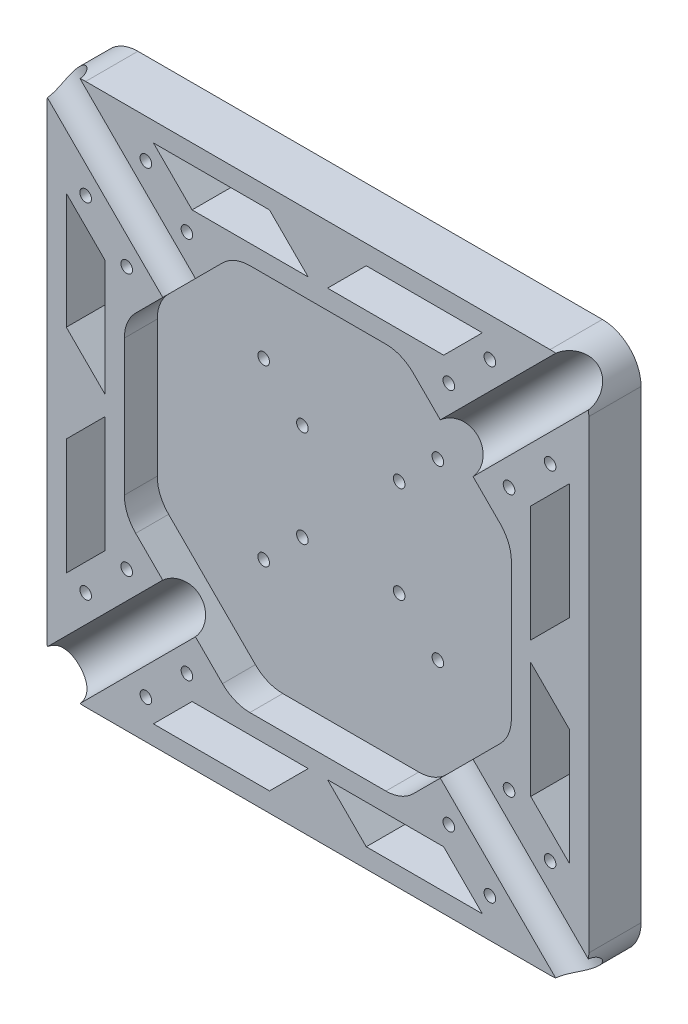
from build123d import *

# Parameters (mm, degrees)
ESQUISSE1_W                  = 140
ESQUISSE1_H                  = 140
BOSS_EXTRU_1_DEPTH           = 13.5
ENL_V_MAT_EXTRU_3_DEPTH      = 8.5
ENL_V_MAT_EXTRU_1_DEPTH      = 100
R_P_TITION_CIRCULAIRE1_COUNT = 2
R_P_TITION_CIRCULAIRE1_ANGLE = 90
CONG_1_R                     = 10
ESQUISSE3_R                  = 1.5
ENL_V_MAT_EXTRU_2_DEPTH      = 13.5
ENL_V_MAT_EXTRU_4_DEPTH      = 10
ENL_V_MAT_EXTRU_4_DEPTH_BACK = 12.5
ESQUISSE5_R                  = 1.5


with BuildPart() as part:
    # Esquisse1 → Boss.-Extru.1 (new body)
    with BuildSketch(Plane.XY):
        Rectangle(ESQUISSE1_W, ESQUISSE1_H)
        Polygon((65, 12.5), (55, 2.5), (55, 32.5), (65, 42.5), align=None, mode=Mode.SUBTRACT)
        Polygon((65, -12.5), (55, -2.5), (55, -32.5), (65, -42.5), align=None, mode=Mode.SUBTRACT)
        Polygon((12.5, -65), (2.5, -55), (32.5, -55), (42.5, -65), align=None, mode=Mode.SUBTRACT)
        Polygon((-12.5, -65), (-2.5, -55), (-32.5, -55), (-42.5, -65), align=None, mode=Mode.SUBTRACT)
        Polygon((-65, -12.5), (-55, -2.5), (-55, -32.5), (-65, -42.5), align=None, mode=Mode.SUBTRACT)
        Polygon((-65, 12.5), (-55, 2.5), (-55, 32.5), (-65, 42.5), align=None, mode=Mode.SUBTRACT)
        Polygon((-12.5, 65), (-2.5, 55), (-32.5, 55), (-42.5, 65), align=None, mode=Mode.SUBTRACT)
        Polygon((12.5, 65), (2.5, 55), (32.5, 55), (42.5, 65), align=None, mode=Mode.SUBTRACT)
    extrude(amount=BOSS_EXTRU_1_DEPTH)

    # Esquisse4 → Enlèv. mat.-Extru.3 (cut)
    with BuildSketch(Plane.XY.offset(13.5)):
        Polygon((-21.715728753, 50), (-50, 21.715728753), (-50, -21.715728753), (-21.715728753, -50), (21.715728753, -50), (50, -21.715728753), (50, 21.715728753), (21.715728753, 50), align=None)
    extrude(amount=-ENL_V_MAT_EXTRU_3_DEPTH, mode=Mode.SUBTRACT)

    # Esquisse2 → Enlèv. mat.-Extru.1 (cut, symmetric)
    with BuildSketch(Plane(origin=(0, 0, 0), x_dir=(-0.7071067811865475, -0.7071067811865477, 0), z_dir=(-0.7071067811865477, 0.7071067811865475, 0))):
        with BuildLine():
            Line((-6, 14), (6, 14))
            ThreePointArc((6, 14), (0, 8), (-6, 14))
        make_face()
    enl_v_mat_extru_1 = extrude(amount=ENL_V_MAT_EXTRU_1_DEPTH, both=True, mode=Mode.SUBTRACT)

    # Répétition circulaire1: Enlèv. mat.-Extru.1 ×2 about axis
    r_p_tition_circulaire1_axis = Axis((0, 0, -62.841973852), (0, 0, 1))
    for i in range(1, R_P_TITION_CIRCULAIRE1_COUNT):
        add(enl_v_mat_extru_1.rotate(r_p_tition_circulaire1_axis, i * R_P_TITION_CIRCULAIRE1_ANGLE / (R_P_TITION_CIRCULAIRE1_COUNT - 1)), mode=Mode.SUBTRACT)

    # Congé1
    cong_1_edges = [part.edges().sort_by_distance(p)[0] for p in [
        (-70, 70, 4),
        (-70, -70, 4),
        (70, 70, 4),
        (70, -70, 4),
        (-21.715728753, -50, 9.25),
        (21.715728753, -50, 9.25),
        (50, -21.715728753, 9.25),
        (50, 21.715728753, 9.25),
        (21.715728753, 50, 9.25),
        (-21.715728753, 50, 9.25),
        (-50, -21.715728753, 9.25),
        (-50, 21.715728753, 9.25),
    ]]
    fillet(cong_1_edges, radius=CONG_1_R)

    # Esquisse3 → Enlèv. mat.-Extru.2 (cut)
    with BuildSketch(Plane.XY.offset(13.5)):
        with Locations((-60, -44.443650814)):
            Circle(ESQUISSE3_R)
        with Locations((-44.443650814, -60)):
            Circle(ESQUISSE3_R)
        with Locations((-44.443650814, 60)):
            Circle(ESQUISSE3_R)
        with Locations((-60, 44.443650814)):
            Circle(ESQUISSE3_R)
        with Locations((60, 44.443650814)):
            Circle(ESQUISSE3_R)
        with Locations((44.443650814, 60)):
            Circle(ESQUISSE3_R)
        with Locations((44.443650814, -60)):
            Circle(ESQUISSE3_R)
        with Locations((60, -44.443650814)):
            Circle(ESQUISSE3_R)
    extrude(amount=-ENL_V_MAT_EXTRU_2_DEPTH, mode=Mode.SUBTRACT)

    # Esquisse5 → Enlèv. mat.-Extru.4 (cut, two sides: drawn at the far end of the back side and taken through both)
    with BuildSketch(Plane.XY.offset(5).offset(-ENL_V_MAT_EXTRU_4_DEPTH_BACK)):
        with Locations((-22.5, 22.5)):
            Circle(ESQUISSE5_R)
        with Locations((22.499999975, 22.498488866)):
            Circle(ESQUISSE5_R)
        with Locations((-22.500000025, -22.5)):
            Circle(ESQUISSE5_R)
        with Locations((22.499999975, -22.501511134)):
            Circle(ESQUISSE5_R)
        with Locations((-12.5, 12.5)):
            Circle(ESQUISSE5_R)
        with Locations((12.5, 12.5)):
            Circle(ESQUISSE5_R)
        with Locations((12.5, -12.5)):
            Circle(ESQUISSE5_R)
        with Locations((-12.5, -12.5)):
            Circle(ESQUISSE5_R)
        with Locations((33.837049096, 49.393398282)):
            Circle(ESQUISSE5_R)
        with Locations((49.393398282, 33.837049096)):
            Circle(ESQUISSE5_R)
        with Locations((49.393398282, -33.837049096)):
            Circle(ESQUISSE5_R)
        with Locations((33.837049096, -49.393398282)):
            Circle(ESQUISSE5_R)
        with Locations((-33.837049096, -49.393398282)):
            Circle(ESQUISSE5_R)
        with Locations((-49.393398282, -33.837049096)):
            Circle(ESQUISSE5_R)
        with Locations((-49.393398282, 33.837049096)):
            Circle(ESQUISSE5_R)
        with Locations((-33.837049096, 49.393398282)):
            Circle(ESQUISSE5_R)
    extrude(amount=ENL_V_MAT_EXTRU_4_DEPTH + ENL_V_MAT_EXTRU_4_DEPTH_BACK, mode=Mode.SUBTRACT)


solid = part.part
